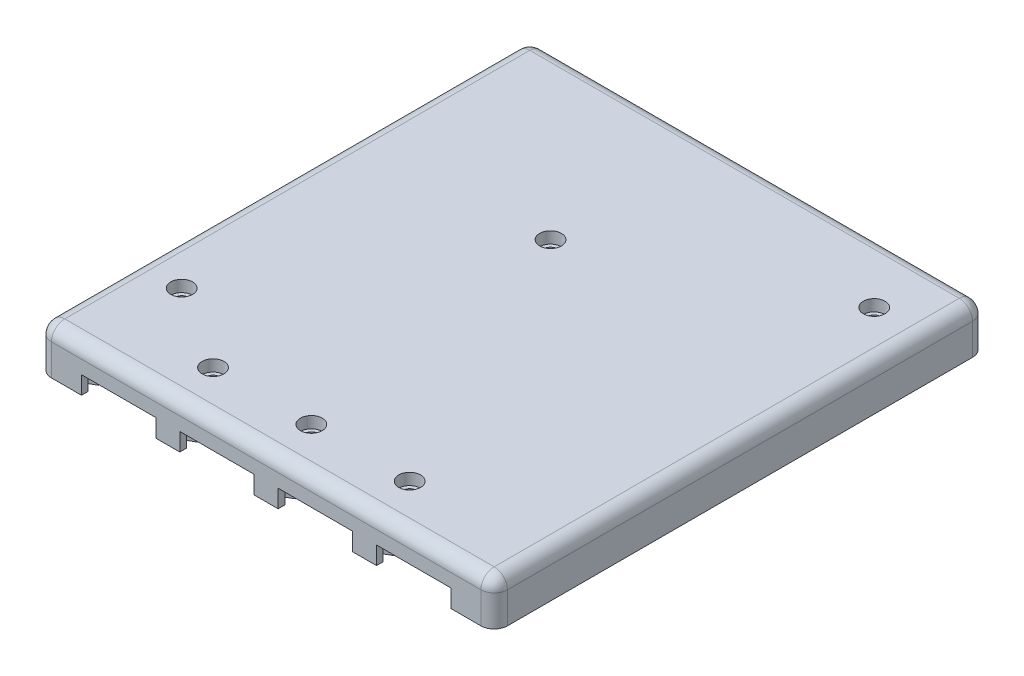
from build123d import *

# Parameters (mm, degrees)
SKETCH1_W           = 85.8
SKETCH1_H           = 92.5
SKETCH1_R           = 2.05
BOSS_EXTRUDE1_DEPTH = 3.175
SKETCH2_W           = 85.8
SKETCH2_H           = 92.5
SKETCH2_R           = 1.35
SKETCH2_R_2         = 3.35
BOSS_EXTRUDE2_DEPTH = 1.905
BOSS_EXTRUDE3_START = 1
SKETCH2_3_W         = 85.8
SKETCH2_3_H         = 92.5
SKETCH2_3_R         = 1.35
SKETCH2_3_R_2       = 3.35
BOSS_EXTRUDE3_DEPTH = 1
SKETCH3_W           = 85.8
SKETCH3_H           = 92.5
SKETCH3_W_2         = 75.8
SKETCH3_H_2         = 82.5
BOSS_EXTRUDE4_DEPTH = 3.3
SKETCH4_W           = 14
SKETCH4_H           = 6.75
CUT_EXTRUDE1_DEPTH  = 118.802300593
SKETCH5_W           = 10
SKETCH5_H           = 6
CUT_EXTRUDE2_DEPTH  = 118.802300593
BOSS_EXTRUDE5_DEPTH = 3.5
FILLET1_R           = 2.5
FILLET2_R           = 2.5
FILLET3_R           = 2.5
FILLET4_R           = 2.5
FILLET5_R           = 2.5
CUT_EXTRUDE3_DEPTH  = 3.36
CUT_EXTRUDE4_DEPTH  = 75
SKETCH10_W          = 4.501
SKETCH10_H          = 2
BOSS_EXTRUDE6_DEPTH = 5
SKETCH13_R          = 6.35
CUT_EXTRUDE5_DEPTH  = 2.5


with BuildPart() as part:
    # Sketch1 → Boss-Extrude1 (new body)
    with BuildSketch(Plane(origin=(0, 0, 0), x_dir=(1, 0, 0), z_dir=(0, 1, 0))):
        with Locations((36.9, 40.25)):
            Rectangle(SKETCH1_W, SKETCH1_H)
        with Locations((2.5, 12.5)):
            Circle(SKETCH1_R, mode=Mode.SUBTRACT)
        with Locations((18.4, 2.5)):
            Circle(SKETCH1_R, mode=Mode.SUBTRACT)
        with Locations((36.9, 2.5)):
            Circle(SKETCH1_R, mode=Mode.SUBTRACT)
        with Locations((55.4, 2.5)):
            Circle(SKETCH1_R, mode=Mode.SUBTRACT)
        with Locations((29.3, 55.1)):
            Circle(SKETCH1_R, mode=Mode.SUBTRACT)
        with Locations((70.8, 74.5)):
            Circle(SKETCH1_R, mode=Mode.SUBTRACT)
    extrude(amount=BOSS_EXTRUDE1_DEPTH)

    # Sketch2 → Boss-Extrude2 (add)
    # profile 1 of 2: a face of its own
    with BuildSketch(Plane(origin=(0, 0, 0), x_dir=(1, 0, 0), z_dir=(0, 1, 0))):
        with Locations((36.9, 40.25)):
            Rectangle(SKETCH2_W, SKETCH2_H)
        with Locations((2.5, 12.5)):
            Circle(SKETCH2_R, mode=Mode.SUBTRACT)
        with Locations((18.4, 2.5)):
            Circle(SKETCH2_R, mode=Mode.SUBTRACT)
        with Locations((36.9, 2.5)):
            Circle(SKETCH2_R, mode=Mode.SUBTRACT)
        with Locations((55.4, 2.5)):
            Circle(SKETCH2_R, mode=Mode.SUBTRACT)
        with BuildLine():
            Line((-1, 7.5), (2.5, 7.5))
            ThreePointArc((2.5, 7.5), (7.5, 12.5), (2.5, 17.5))
            Line((2.5, 17.5), (-1, 17.5))
            Line((-1, 17.5), (-1, 81.5))
            Line((-1, 81.5), (65.8, 81.5))
            Line((65.8, 81.5), (65.8, 74.5))
            ThreePointArc((65.8, 74.5), (67.264466094, 70.964466094), (70.8, 69.5))
            Line((70.8, 69.5), (74.8, 69.5))
            Line((74.8, 69.5), (74.8, -1))
            Line((74.8, -1), (60.4, -1))
            Line((60.4, -1), (60.4, 2.5))
            ThreePointArc((60.4, 2.5), (55.4, 7.5), (50.4, 2.5))
            Line((50.4, 2.5), (50.4, -1))
            Line((50.4, -1), (41.9, -1))
            Line((41.9, -1), (41.9, 2.5))
            ThreePointArc((41.9, 2.5), (36.9, 7.5), (31.9, 2.5))
            Line((31.9, 2.5), (31.9, -1))
            Line((31.9, -1), (23.4, -1))
            Line((23.4, -1), (23.4, 2.5))
            ThreePointArc((23.4, 2.5), (18.4, 7.5), (13.4, 2.5))
            Line((13.4, 2.5), (13.4, -1))
            Line((13.4, -1), (-1, -1))
            Line((-1, -1), (-1, 7.5))
        make_face(mode=Mode.SUBTRACT)
        with Locations((70.8, 74.5)):
            Circle(SKETCH2_R, mode=Mode.SUBTRACT)
    # profile 2 of 2: a face of its own
    with BuildSketch(Plane(origin=(0, 0, 0), x_dir=(1, 0, 0), z_dir=(0, 1, 0))):
        with Locations((29.3, 55.1)):
            Circle(SKETCH2_R_2)
        with Locations((29.3, 55.1)):
            Circle(SKETCH2_R, mode=Mode.SUBTRACT)
    extrude(amount=-BOSS_EXTRUDE2_DEPTH)

    # Sketch2<3> → Boss-Extrude3 (add)
    # profile 1 of 2: a face of its own
    with BuildSketch(Plane(origin=(0, 0, 0), x_dir=(1, 0, 0), z_dir=(0, 1, 0)).offset(BOSS_EXTRUDE3_START)):
        with Locations((36.9, 40.25)):
            Rectangle(SKETCH2_3_W, SKETCH2_3_H)
        with Locations((2.5, 12.5)):
            Circle(SKETCH2_3_R, mode=Mode.SUBTRACT)
        with Locations((18.4, 2.5)):
            Circle(SKETCH2_3_R, mode=Mode.SUBTRACT)
        with Locations((36.9, 2.5)):
            Circle(SKETCH2_3_R, mode=Mode.SUBTRACT)
        with Locations((55.4, 2.5)):
            Circle(SKETCH2_3_R, mode=Mode.SUBTRACT)
        with BuildLine():
            Line((-1, 7.5), (2.5, 7.5))
            ThreePointArc((2.5, 7.5), (7.5, 12.5), (2.5, 17.5))
            Line((2.5, 17.5), (-1, 17.5))
            Line((-1, 17.5), (-1, 81.5))
            Line((-1, 81.5), (65.8, 81.5))
            Line((65.8, 81.5), (65.8, 74.5))
            ThreePointArc((65.8, 74.5), (67.264466094, 70.964466094), (70.8, 69.5))
            Line((70.8, 69.5), (74.8, 69.5))
            Line((74.8, 69.5), (74.8, -1))
            Line((74.8, -1), (60.4, -1))
            Line((60.4, -1), (60.4, 2.5))
            ThreePointArc((60.4, 2.5), (55.4, 7.5), (50.4, 2.5))
            Line((50.4, 2.5), (50.4, -1))
            Line((50.4, -1), (41.9, -1))
            Line((41.9, -1), (41.9, 2.5))
            ThreePointArc((41.9, 2.5), (36.9, 7.5), (31.9, 2.5))
            Line((31.9, 2.5), (31.9, -1))
            Line((31.9, -1), (23.4, -1))
            Line((23.4, -1), (23.4, 2.5))
            ThreePointArc((23.4, 2.5), (18.4, 7.5), (13.4, 2.5))
            Line((13.4, 2.5), (13.4, -1))
            Line((13.4, -1), (-1, -1))
            Line((-1, -1), (-1, 7.5))
        make_face(mode=Mode.SUBTRACT)
        with Locations((70.8, 74.5)):
            Circle(SKETCH2_3_R, mode=Mode.SUBTRACT)
    # profile 2 of 2: a face of its own
    with BuildSketch(Plane(origin=(0, 0, 0), x_dir=(1, 0, 0), z_dir=(0, 1, 0)).offset(BOSS_EXTRUDE3_START)):
        with Locations((29.3, 55.1)):
            Circle(SKETCH2_3_R_2)
        with Locations((29.3, 55.1)):
            Circle(SKETCH2_3_R, mode=Mode.SUBTRACT)
    extrude(amount=-BOSS_EXTRUDE3_DEPTH)

    # Sketch3 → Boss-Extrude4 (add)
    with BuildSketch(Plane(origin=(0, -1.905, 0), x_dir=(-1, 0, 0), z_dir=(0, -1, 0))):
        with Locations((-36.9, 40.25)):
            Rectangle(SKETCH3_W, SKETCH3_H)
        with Locations((-36.9, 40.25)):
            Rectangle(SKETCH3_W_2, SKETCH3_H_2, mode=Mode.SUBTRACT)
    extrude(amount=BOSS_EXTRUDE4_DEPTH)

    # Sketch4 → Cut-Extrude1 (cut, through all)
    with BuildSketch(Plane.XY):
        with Locations((9.15, -5.22)):
            Rectangle(SKETCH4_W, SKETCH4_H)
        with Locations((27.65, -5.22)):
            Rectangle(SKETCH4_W, SKETCH4_H)
        with Locations((46.15, -5.22)):
            Rectangle(SKETCH4_W, SKETCH4_H)
        with Locations((64.65, -5.22)):
            Rectangle(SKETCH4_W, SKETCH4_H)
    extrude(amount=CUT_EXTRUDE1_DEPTH, mode=Mode.SUBTRACT)

    # Sketch5 → Cut-Extrude2 (cut, through all)
    with BuildSketch(Plane.XY):
        with Locations((58, -6.205)):
            Rectangle(SKETCH5_W, SKETCH5_H)
    extrude(amount=-CUT_EXTRUDE2_DEPTH, mode=Mode.SUBTRACT)

    # Sketch6 → Boss-Extrude5 (add)
    with BuildSketch(Plane.ZY.offset(6)):
        with BuildLine():
            Line((-59.6, 0), (-59.6, -8.95))
            Line((-59.6, -8.95), (-59.131128874, -8.95))
            ThreePointArc((-59.131128874, -8.95), (-55.1, -6.45), (-51.068871126, -8.95))
            Line((-51.068871126, -8.95), (-50.6, -8.95))
            Line((-50.6, -8.95), (-50.6, 0))
            Line((-50.6, 0), (-59.6, 0))
        make_face()
    extrude(amount=-BOSS_EXTRUDE5_DEPTH)

    # Fillet1
    fillet1_edges = [part.edges().sort_by_distance(p)[0] for p in [
        (79.8, -1.015, 6),
    ]]
    fillet(fillet1_edges, radius=FILLET1_R)

    # Fillet2
    fillet2_edges = [part.edges().sort_by_distance(p)[0] for p in [
        (79.8, -1.015, -86.5),
    ]]
    fillet(fillet2_edges, radius=FILLET2_R)

    # Fillet3
    fillet3_edges = [part.edges().sort_by_distance(p)[0] for p in [
        (-6, -1.015, -86.5),
    ]]
    fillet(fillet3_edges, radius=FILLET3_R)

    # Fillet4
    fillet4_edges = [part.edges().sort_by_distance(p)[0] for p in [
        (-6, -1.015, 6),
    ]]
    fillet(fillet4_edges, radius=FILLET4_R)

    # Fillet5
    fillet5_edges = [part.edges().sort_by_distance(p)[0] for p in [
        (79.067766953, 3.175, -85.767766953),
        (79.8, 3.175, -40.25),
        (79.067766953, 3.175, 5.267766953),
        (36.9, 3.175, 6),
        (-5.267766953, 3.175, 5.267766953),
        (-6, 3.175, -40.25),
        (-5.267766953, 3.175, -85.767766953),
        (36.9, 3.175, -86.5),
    ]]
    fillet(fillet5_edges, radius=FILLET5_R)

    # Sketch7 → Cut-Extrude3 (cut)
    with BuildSketch(Plane(origin=(0, -5.205, 0), x_dir=(-1, 0, 0), z_dir=(0, -1, 0))):
        Polygon((-2.15, -2.75), (-0.4, -3.75), (-2.15, -4.75), align=None)
        Polygon((-16.15, -2.75), (-17.9, -3.75), (-16.15, -4.75), align=None)
        Polygon((-20.65, -2.75), (-18.9, -3.75), (-20.65, -4.75), align=None)
        Polygon((-34.65, -2.75), (-36.4, -3.75), (-34.65, -4.75), align=None)
        Polygon((-39.15, -2.75), (-39.15, -4.75), (-37.4, -3.75), align=None)
        Polygon((-53.15, -2.75), (-53.15, -4.75), (-54.9, -3.75), align=None)
        Polygon((-57.65, -4.75), (-55.9, -3.75), (-57.65, -2.75), align=None)
        Polygon((-71.65, -2.75), (-73.4, -3.75), (-71.65, -4.75), align=None)
    extrude(amount=-CUT_EXTRUDE3_DEPTH, mode=Mode.SUBTRACT)

    # Sketch8 → Cut-Extrude4 (cut)
    with BuildSketch(Plane(origin=(0, 0, 0), x_dir=(0, 0, -1), z_dir=(1, 0, 0))):
        Polygon((-4.75, -1.9), (-2.75, -1.9), (-3.75, -0.15), align=None)
    extrude(amount=CUT_EXTRUDE4_DEPTH, mode=Mode.SUBTRACT)

    # Sketch10 → Boss-Extrude6 (add)
    with BuildSketch(Plane.XY.offset(6)):
        with Locations((-0.1005, -0.845)):
            Rectangle(SKETCH10_W, SKETCH10_H)
        with Locations((18.3995, -0.845)):
            Rectangle(SKETCH10_W, SKETCH10_H)
        with Locations((36.8995, -0.845)):
            Rectangle(SKETCH10_W, SKETCH10_H)
        with Locations((55.3995, -0.845)):
            Rectangle(SKETCH10_W, SKETCH10_H)
        with Locations((73.9005, -0.845)):
            Rectangle(SKETCH10_W, SKETCH10_H)
    extrude(amount=-BOSS_EXTRUDE6_DEPTH)

    # Sketch13 → Cut-Extrude5 (cut)
    with BuildSketch(Plane(origin=(0, 0, 0), x_dir=(0, 0, -1), z_dir=(1, 0, 0))):
        with Locations((55.1, -10.95)):
            Circle(SKETCH13_R)
    extrude(amount=-CUT_EXTRUDE5_DEPTH, mode=Mode.SUBTRACT)


solid = part.part
